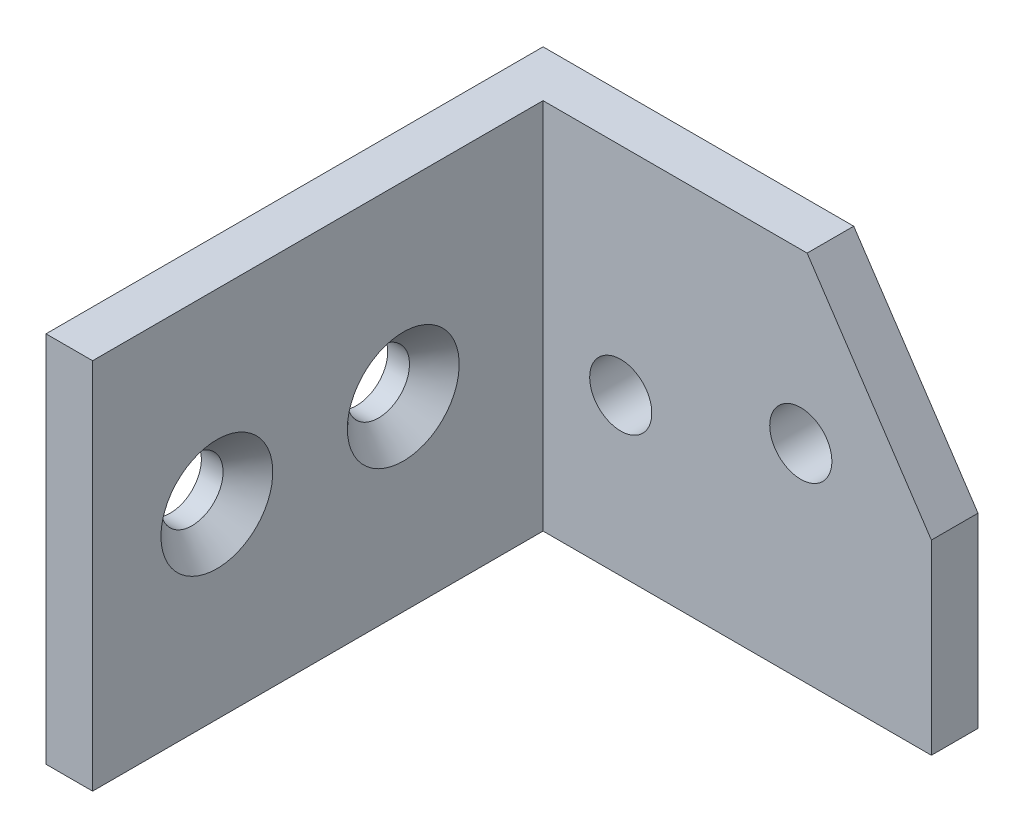
from build123d import *

# Parameters (mm, degrees)
BOSS_EXTRUDE1_DEPTH     = 38.1
SKETCH2_R               = 3.175
CUT_EXTRUDE1_DEPTH      = 38.1
CUT_EXTRUDE3_REACH      = 79.512
SKETCH3_R               = 3.175
CUT_EXTRUDE4_DEPTH      = 75.882225236
CUT_EXTRUDE4_DEPTH_BACK = 75.882225236
CHAMFER1_SIZE           = 2.54


with BuildPart() as part:
    # Sketch1 → Boss-Extrude1 (new body)
    with BuildSketch(Plane(origin=(0, 0, 0), x_dir=(1, 0, 0), z_dir=(0, 1, 0))):
        Polygon((0, 0), (0, 46.0375), (39.6875, 46.0375), (39.6875, 50.8), (-4.7625, 50.8), (-4.7625, 0), align=None)
    extrude(amount=BOSS_EXTRUDE1_DEPTH)

    # Sketch2 → Cut-Extrude1 (cut)
    with BuildSketch(Plane(origin=(0, 0, -50.8), x_dir=(-1, 0, 0), z_dir=(0, 0, -1))):
        with Locations((-26.338386991, 20.92691832)):
            Circle(SKETCH2_R)
        with Locations((-7.9375, 15.996415511)):
            Circle(SKETCH2_R)
    extrude(amount=-CUT_EXTRUDE1_DEPTH, mode=Mode.SUBTRACT)

    # Sketch3 → Cut-Extrude3 (cut, up to next)
    with BuildSketch(Plane.ZY.offset(4.7625), mode=Mode.PRIVATE) as cut_extrude3_sk1:
        with Locations((-12.7, 19.05)):
            Circle(SKETCH3_R)
    cut_extrude3_tool1 = extrude(cut_extrude3_sk1.sketch, amount=-CUT_EXTRUDE3_REACH, mode=Mode.PRIVATE) & part.part
    # Sketch3 → Cut-Extrude3 (cut, up to next)
    with BuildSketch(Plane.ZY.offset(4.7625), mode=Mode.PRIVATE) as cut_extrude3_sk2:
        with Locations((-31.75, 19.05)):
            Circle(SKETCH3_R)
    cut_extrude3_tool2 = extrude(cut_extrude3_sk2.sketch, amount=-CUT_EXTRUDE3_REACH, mode=Mode.PRIVATE) & part.part
    add(cut_extrude3_tool1.solids().sort_by_distance((-4.7625, 19.05, -12.7))[0], mode=Mode.SUBTRACT)
    add(cut_extrude3_tool2.solids().sort_by_distance((-4.7625, 19.05, -31.75))[0], mode=Mode.SUBTRACT)

    # Sketch4 → Cut-Extrude4 (cut, two sides: drawn at the far end of the back side and taken through both)
    with BuildSketch(Plane(origin=(0, 0, -50.8), x_dir=(-1, 0, 0), z_dir=(0, 0, -1)).offset(-CUT_EXTRUDE4_DEPTH_BACK)):
        Polygon((33.580309215, 128.951713823), (-26.9875, 38.1), (-39.6875, 19.05), (-100.255309215, -71.801713823), (-281.958736861, 49.333904608), (-148.12311843, 250.087332253), align=None)
    extrude(amount=CUT_EXTRUDE4_DEPTH + CUT_EXTRUDE4_DEPTH_BACK, mode=Mode.SUBTRACT)

    # Chamfer1
    chamfer1_edges = [part.edges().sort_by_distance(p)[0] for p in [
        (0, 19.05, -15.875),
        (0, 19.05, -34.925),
    ]]
    chamfer(chamfer1_edges, length=CHAMFER1_SIZE)


solid = part.part
